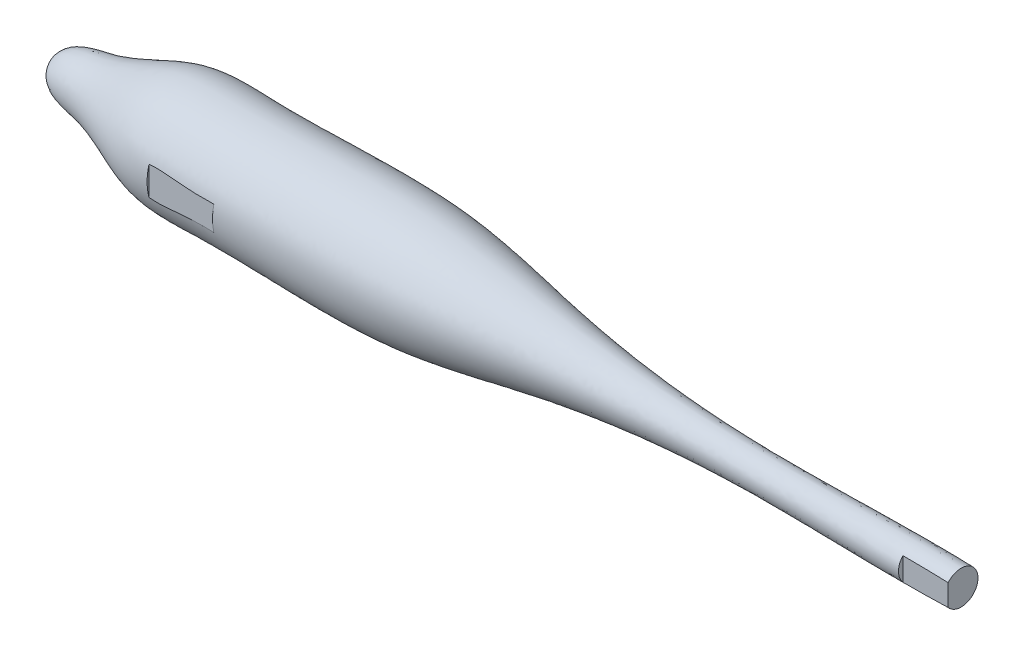
from build123d import *

# Parameters (mm, degrees)
SKETCH5_W          = 100
SKETCH5_H          = 222.958212689
CUT_EXTRUDE2_DEPTH = 17
SKETCH7_W          = 70
SKETCH7_H          = 50
CUT_EXTRUDE3_DEPTH = 80


with BuildPart() as part:
    # Sketch1 → Revolve2 (revolve)
    with BuildSketch(Plane.XY):
        with BuildLine():
            Line((0, 0), (1400, 0))
            Line((1400, 0), (1400, 25.997014576))
            add(Edge.make_bspline(
                [(0, 0), (6.007862839, 35.12054136), (87.570445438, 35.979993634), (174.285504865, 89.884927882), (355.229810131, 80.463468301), (551.199038272, 98.190296267), (802.566829119, 43.065619564), (1072.41205954, 17.747902618), (1281.149711777, 28.859320036), (1400, 25.997014576)],
                knots=[0, 0, 0, 0, 0.060908752, 0.147322495, 0.213188607, 0.431416814, 0.561861324, 0.750119802, 1, 1, 1, 1], degree=3))
        make_face()
    revolve(axis=Axis((0, 0, 0), (1, 0, 0)))

    # Sketch5 → Cut-Extrude2 (cut)
    with BuildSketch(Plane.XY.offset(100)):
        with Locations((280.534172386, 15.00871039)):
            Rectangle(SKETCH5_W, SKETCH5_H)
    extrude(amount=-CUT_EXTRUDE2_DEPTH, mode=Mode.SUBTRACT)

    # Sketch7 → Cut-Extrude3 (cut)
    with BuildSketch(Plane.XY.offset(100)):
        with Locations((1365.10148425, 0)):
            Rectangle(SKETCH7_W, SKETCH7_H)
    extrude(amount=-CUT_EXTRUDE3_DEPTH, mode=Mode.SUBTRACT)


solid = part.part
